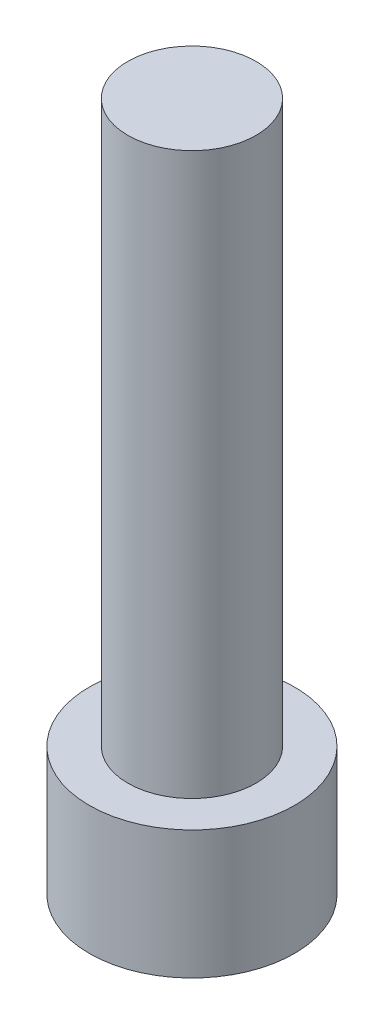
from build123d import *

# Parameters (mm, degrees)
SKETCH_2_R          = 6.4
EXTRUDE_1_DEPTH     = 8
CUT_EXTRUDE_2_DEPTH = 6
SKETCH_4_R          = 4
EXTRUDE_3_DEPTH     = 35


with BuildPart() as part:
    # Эскиз2 → Вытянуть1 (new body)
    with BuildSketch(Plane(origin=(0, 0, 0), x_dir=(1, 0, 0), z_dir=(0, 1, 0))):
        Circle(SKETCH_2_R)
    extrude(amount=EXTRUDE_1_DEPTH)

    # Эскиз3 → Вытянуть2 (cut)
    with BuildSketch(Plane.XZ):
        Polygon((-1.64328585, -4.006196652), (2.647825149, -3.426225618), (4.291110998, 0.579971035), (1.64328585, 4.006196652), (-2.647825149, 3.426225618), (-4.291110998, -0.579971035), align=None)
    extrude(amount=-CUT_EXTRUDE_2_DEPTH, mode=Mode.SUBTRACT)

    # Эскиз4 → Вытянуть3 (add)
    with BuildSketch(Plane(origin=(0, 8, 0), x_dir=(-1, 0, 0), z_dir=(0, 1, 0))):
        Circle(SKETCH_4_R)
    extrude(amount=EXTRUDE_3_DEPTH)


solid = part.part
